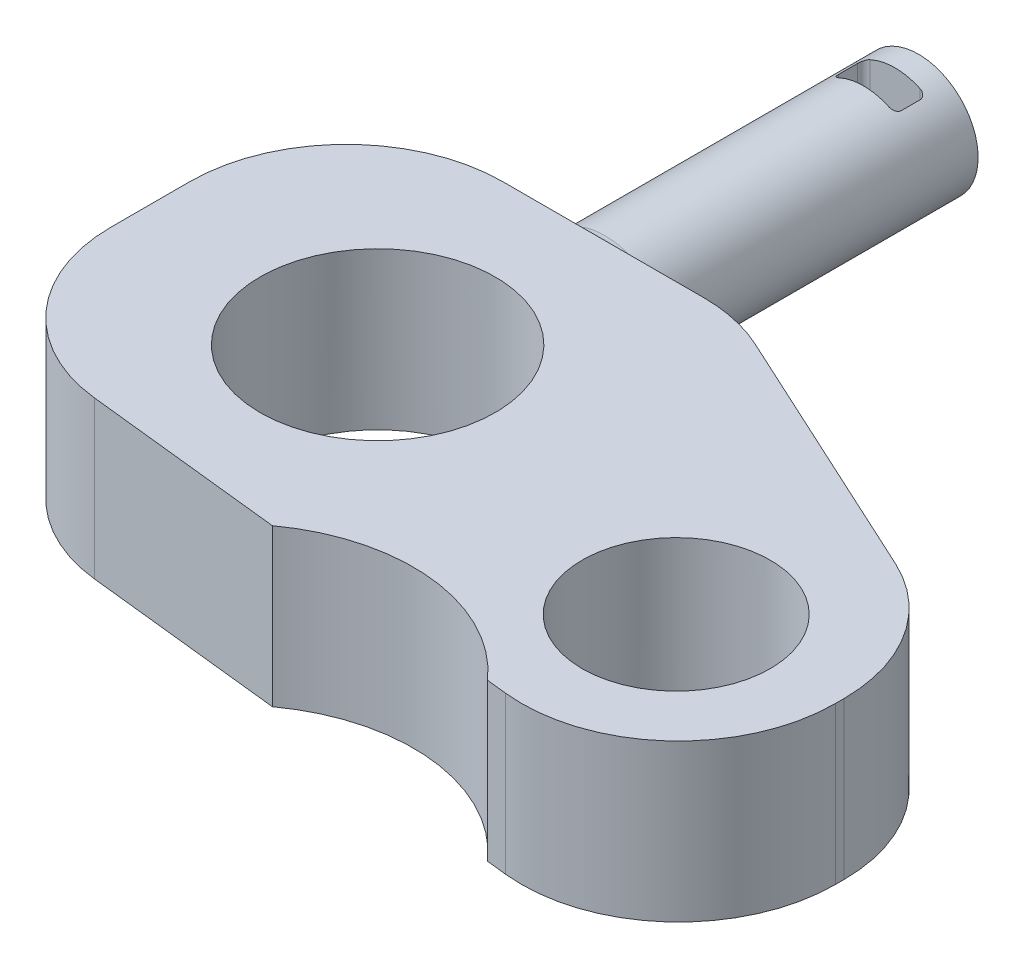
from build123d import *

# Parameters (mm, degrees)
SKETCH1_R           = 5
BOSS_EXTRUDE1_DEPTH = 20
SKETCH2_R           = 5
SKETCH2_R_2         = 3.98
CUT_EXTRUDE2_DEPTH  = 8
SKETCH8_R           = 5
BOSS_EXTRUDE2_DEPTH = 20
BOSS_EXTRUDE3_START = -31.5
BOSS_EXTRUDE3_DEPTH = 31.5
BOSS_EXTRUDE4_START = -31.5
BOSS_EXTRUDE4_DEPTH = 31.5
SKETCH12_R          = 7.5
SKETCH12_R_2        = 6
CUT_EXTRUDE3_DEPTH  = 31.5
CUT_EXTRUDE4_DEPTH  = 55.083269132
FILLET1_R           = 10
BOSS_EXTRUDE5_START = 13
SKETCH17_R          = 3.98
BOSS_EXTRUDE5_DEPTH = 13
CUT_EXTRUDE5_DEPTH  = 52.315568407
SKETCH19_R          = 5
SKETCH19_R_2        = 3.98
CUT_EXTRUDE6_DEPTH  = 0.5
SKETCH20_R          = 3.98
SKETCH20_R_2        = 3.8
CUT_EXTRUDE7_DEPTH  = 21.5
FILLET2_R           = 1.5
CUT_EXTRUDE9_DEPTH  = 10


with BuildPart() as part:
    # Sketch1 → Boss-Extrude1 (new body)
    with BuildSketch(Plane.XY):
        Circle(SKETCH1_R)
    extrude(amount=BOSS_EXTRUDE1_DEPTH)

    # Sketch2 → Cut-Extrude2 (cut)
    with BuildSketch(Plane(origin=(0, 0, 0), x_dir=(-1, 0, 0), z_dir=(0, 0, -1))):
        Circle(SKETCH2_R)
        Circle(SKETCH2_R_2, mode=Mode.SUBTRACT)
    extrude(amount=-CUT_EXTRUDE2_DEPTH, mode=Mode.SUBTRACT)

    # Sketch8 → Boss-Extrude2 (add)
    with BuildSketch(Plane.XY.offset(20)):
        with Locations(Location((0, 0, 0), (0, 0, 180))):
            Circle(SKETCH8_R)
    extrude(amount=BOSS_EXTRUDE2_DEPTH)

    # Sketch9 → Boss-Extrude3 (add)
    with BuildSketch(Plane.XY.offset(40).offset(BOSS_EXTRUDE3_START)):
        with BuildLine():
            Line((0, 5), (35, 5))
            Line((35, 5), (35, -5))
            Line((35, -5), (0, -5))
            ThreePointArc((0, -5), (5, 0), (0, 5))
        make_face()
    extrude(amount=BOSS_EXTRUDE3_DEPTH)

    # Sketch10 → Boss-Extrude4 (add)
    with BuildSketch(Plane.XY.offset(40).offset(BOSS_EXTRUDE4_START)):
        with BuildLine():
            ThreePointArc((0, -5), (-5, 0), (0, 5))
            Line((0, 5), (-15, 5))
            Line((-15, 5), (-15, -5))
            Line((-15, -5), (0, -5))
        make_face()
    extrude(amount=BOSS_EXTRUDE4_DEPTH)

    # Sketch12 → Cut-Extrude3 (cut)
    with BuildSketch(Plane(origin=(0, 5, 0), x_dir=(1, 0, 0), z_dir=(0, 1, 0))):
        with Locations(Location((0, -21.5, 0), (0, 0, 270))):
            Circle(SKETCH12_R)
        with Locations(Location((24.415869627, -26.872644634, 0), (0, 0, 270))):
            Circle(SKETCH12_R_2)
    extrude(amount=-CUT_EXTRUDE3_DEPTH, mode=Mode.SUBTRACT)

    # Sketch14 → Cut-Extrude4 (cut, through all)
    with BuildSketch(Plane(origin=(0, 5, 0), x_dir=(1, 0, 0), z_dir=(0, 1, 0))):
        Polygon((-15, -40), (35, -40), (35, -37.368304137), (35, -8.5), (10, -8.5), (34.415869627, -19.756213623), (34.415869627, -37.872644634), (-15, -32.5), align=None)
    extrude(amount=-CUT_EXTRUDE4_DEPTH, mode=Mode.SUBTRACT)

    # Fillet1
    fillet1_edges = [part.edges().sort_by_distance(p)[0] for p in [
        (-15, 0, 8.5),
        (34.415869627, 0, 19.756213623),
        (10, 0, 8.5),
        (-15, 0, 32.5),
        (34.415869627, 0, 37.872644634),
    ]]
    fillet(fillet1_edges, radius=FILLET1_R - 0.0001)  # a hair under: the kernel refuses the full size

    # Sketch17 → Boss-Extrude5 (add)
    with BuildSketch(Plane(origin=(0, 0, 0), x_dir=(-1, 0, 0), z_dir=(0, 0, -1)).offset(BOSS_EXTRUDE5_START)):
        Circle(SKETCH17_R)
    extrude(amount=-BOSS_EXTRUDE5_DEPTH)

    # Sketch18 → Cut-Extrude5 (cut, through all)
    with BuildSketch(Plane(origin=(0, 5, 0), x_dir=(1, 0, 0), z_dir=(0, 1, 0))):
        with BuildLine():
            Line((-1.6, 11.5), (1.6, 11.5))
            ThreePointArc((1.6, 11.5), (1.882842712, 11.382842712), (2, 11.1))
            Line((2, 11.1), (2, 9.9))
            ThreePointArc((2, 9.9), (1.882842712, 9.617157288), (1.6, 9.5))
            Line((1.6, 9.5), (-1.6, 9.5))
            ThreePointArc((-1.6, 9.5), (-1.882842712, 9.617157288), (-2, 9.9))
            Line((-2, 9.9), (-2, 11.1))
            ThreePointArc((-2, 11.1), (-1.882842712, 11.382842712), (-1.6, 11.5))
        make_face()
    extrude(amount=-CUT_EXTRUDE5_DEPTH, mode=Mode.SUBTRACT)

    # Sketch19 → Cut-Extrude6 (cut)
    with BuildSketch(Plane(origin=(0, 0, 8), x_dir=(-1, 0, 0), z_dir=(0, 0, -1))):
        Circle(SKETCH19_R)
        Circle(SKETCH19_R_2, mode=Mode.SUBTRACT)
    extrude(amount=-CUT_EXTRUDE6_DEPTH, mode=Mode.SUBTRACT)

    # Sketch20 → Cut-Extrude7 (cut)
    with BuildSketch(Plane(origin=(0, 0, -13), x_dir=(-1, 0, 0), z_dir=(0, 0, -1))):
        Circle(SKETCH20_R)
        Circle(SKETCH20_R_2, mode=Mode.SUBTRACT)
    extrude(amount=-CUT_EXTRUDE7_DEPTH, mode=Mode.SUBTRACT)

    # Fillet2
    fillet2_edges = [part.edges().sort_by_distance(p)[0] for p in [
        (3.8, 0, 8.5),
    ]]
    fillet(fillet2_edges, radius=FILLET2_R)

    # Sketch21 → Cut-Extrude9 (cut)
    with BuildSketch(Plane.XZ.offset(5)):
        with BuildLine():
            Line((22.038458054, 36.526934554), (6.637283612, 34.852471718))
            ThreePointArc((6.637283612, 34.852471718), (14.662129167, 32.707278529), (22.038458054, 36.526934554))
        make_face()
    extrude(amount=-CUT_EXTRUDE9_DEPTH, mode=Mode.SUBTRACT)


solid = part.part
